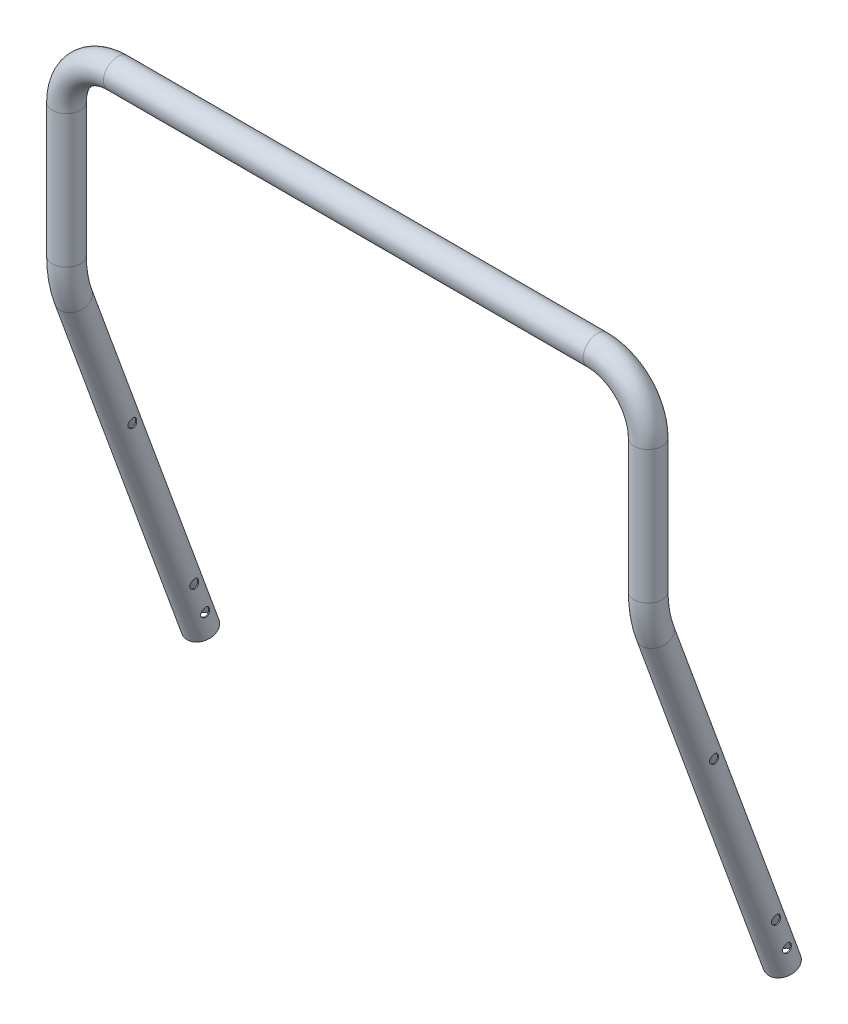
from build123d import *

# Parameters (mm, degrees)
SKETCH9_R                      = 11
SKETCH9_R_2                    = 10.2
SKETCH9_2_R                    = 11
SKETCH9_2_R_2                  = 10.2
CUT_EXTRUDE1_REACH             = 662.264
SKETCH14_R                     = 3.5
CUT_EXTRUDE1_DIRECTION_2_REACH = 662.264


with BuildPart() as part:
    # Sweep2: sweep along a path in Sketch8
    with BuildLine(Plane.XY) as sweep2_path:
        Line((-228, -100), (-228, -40))
        ThreePointArc((-228, -40), (-216.284271247, -11.715728753), (-188, 0))
        Line((-188, 0), (188, 0))
        ThreePointArc((188, 0), (216.284271247, -11.715728753), (228, -40))
        Line((228, -40), (228, -100))
    # Sketch9 → Sweep2 (sweep)
    with BuildSketch(Plane(origin=(228, -100, 0), x_dir=(-1, 0, 0), z_dir=(0, -1, 0))):
        Circle(SKETCH9_R)
        Circle(SKETCH9_R_2, mode=Mode.SUBTRACT)
    sweep(path=sweep2_path.line)

    # Sweep3: sweep along a path in Sketch13
    with BuildLine(Plane(origin=(228, 0, 0), x_dir=(0, 0, -1), z_dir=(1, 0, 0))) as sweep3_path:
        Line((0, -100), (0, -144.259708793))
        ThreePointArc((0, -144.259708793), (1.367302229, -159.888044783), (5.427664129, -175.041521693))
        Line((5.427664129, -175.041521693), (104.967762343, -448.525693866))
    # Sketch9<2> → Sweep3 (sweep)
    with BuildSketch(Plane(origin=(228, -100, 0), x_dir=(-1, 0, 0), z_dir=(0, -1, 0))):
        Circle(SKETCH9_2_R)
        Circle(SKETCH9_2_R_2, mode=Mode.SUBTRACT)
    sweep3 = sweep(path=sweep3_path.line)

    # Mirror1: Sweep3 across plane
    add(sweep3.mirror(Plane(origin=(0, 0, 0), x_dir=(0, 0, 1), z_dir=(1, 0, 0))))

    # Sketch14 → Cut-Extrude1 (cut, up to next)
    with BuildSketch(Plane(origin=(228, 0, 0), x_dir=(0, 0, -1), z_dir=(1, 0, 0)), mode=Mode.PRIVATE) as cut_extrude1_sk1:
        with Locations((41.055908138, -272.929317602)):
            Circle(SKETCH14_R)
    cut_extrude1_tool1 = extrude(cut_extrude1_sk1.sketch, amount=-CUT_EXTRUDE1_REACH, mode=Mode.PRIVATE) & part.part
    # Sketch14 → Cut-Extrude1 (cut, up to next)
    with BuildSketch(Plane(origin=(228, 0, 0), x_dir=(0, 0, -1), z_dir=(1, 0, 0)), mode=Mode.PRIVATE) as cut_extrude1_sk2:
        with Locations((89.622768491, -406.365669754)):
            Circle(SKETCH14_R)
    cut_extrude1_tool2 = extrude(cut_extrude1_sk2.sketch, amount=-CUT_EXTRUDE1_REACH, mode=Mode.PRIVATE) & part.part
    # Sketch14 → Cut-Extrude1 (cut, up to next)
    with BuildSketch(Plane(origin=(228, 0, 0), x_dir=(0, 0, -1), z_dir=(1, 0, 0)), mode=Mode.PRIVATE) as cut_extrude1_sk3:
        with Locations((98.173272074, -429.857985274)):
            Circle(SKETCH14_R)
    cut_extrude1_tool3 = extrude(cut_extrude1_sk3.sketch, amount=-CUT_EXTRUDE1_REACH, mode=Mode.PRIVATE) & part.part
    cut_extrude1_1 = cut_extrude1_tool1.solids().sort_by_distance((228, -272.929318, -41.055908))[0]
    add(cut_extrude1_1, mode=Mode.SUBTRACT)
    cut_extrude1_2 = cut_extrude1_tool2.solids().sort_by_distance((228, -406.36567, -89.622768))[0]
    add(cut_extrude1_2, mode=Mode.SUBTRACT)
    cut_extrude1_3 = cut_extrude1_tool3.solids().sort_by_distance((228, -429.857985, -98.173272))[0]
    add(cut_extrude1_3, mode=Mode.SUBTRACT)
    cut_extrude1 = cut_extrude1_1 + cut_extrude1_2 + cut_extrude1_3  # Cut-Extrude1 as one shape, for the pattern or mirror that repeats it

    # Sketch14 → Cut-Extrude1 direction 2 (cut, up to next)
    with BuildSketch(Plane(origin=(228, 0, 0), x_dir=(0, 0, -1), z_dir=(1, 0, 0)), mode=Mode.PRIVATE) as cut_extrude1_direction_2_sk1:
        with Locations((41.055908138, -272.929317602)):
            Circle(SKETCH14_R)
    cut_extrude1_direction_2_tool1 = extrude(cut_extrude1_direction_2_sk1.sketch, amount=CUT_EXTRUDE1_DIRECTION_2_REACH, mode=Mode.PRIVATE) & part.part
    # Sketch14 → Cut-Extrude1 direction 2 (cut, up to next)
    with BuildSketch(Plane(origin=(228, 0, 0), x_dir=(0, 0, -1), z_dir=(1, 0, 0)), mode=Mode.PRIVATE) as cut_extrude1_direction_2_sk2:
        with Locations((89.622768491, -406.365669754)):
            Circle(SKETCH14_R)
    cut_extrude1_direction_2_tool2 = extrude(cut_extrude1_direction_2_sk2.sketch, amount=CUT_EXTRUDE1_DIRECTION_2_REACH, mode=Mode.PRIVATE) & part.part
    # Sketch14 → Cut-Extrude1 direction 2 (cut, up to next)
    with BuildSketch(Plane(origin=(228, 0, 0), x_dir=(0, 0, -1), z_dir=(1, 0, 0)), mode=Mode.PRIVATE) as cut_extrude1_direction_2_sk3:
        with Locations((98.173272074, -429.857985274)):
            Circle(SKETCH14_R)
    cut_extrude1_direction_2_tool3 = extrude(cut_extrude1_direction_2_sk3.sketch, amount=CUT_EXTRUDE1_DIRECTION_2_REACH, mode=Mode.PRIVATE) & part.part
    cut_extrude1_direction_2_1 = cut_extrude1_direction_2_tool1.solids().sort_by_distance((228, -272.929318, -41.055908))[0]
    add(cut_extrude1_direction_2_1, mode=Mode.SUBTRACT)
    cut_extrude1_direction_2_2 = cut_extrude1_direction_2_tool2.solids().sort_by_distance((228, -406.36567, -89.622768))[0]
    add(cut_extrude1_direction_2_2, mode=Mode.SUBTRACT)
    cut_extrude1_direction_2_3 = cut_extrude1_direction_2_tool3.solids().sort_by_distance((228, -429.857985, -98.173272))[0]
    add(cut_extrude1_direction_2_3, mode=Mode.SUBTRACT)
    cut_extrude1_direction_2 = cut_extrude1_direction_2_1 + cut_extrude1_direction_2_2 + cut_extrude1_direction_2_3  # Cut-Extrude1 direction 2 as one shape, for the pattern or mirror that repeats it

    # Mirror2: Cut-Extrude1, Cut-Extrude1 direction 2 across plane
    add(cut_extrude1.mirror(Plane(origin=(0, 0, 0), x_dir=(0, 0, 1), z_dir=(1, 0, 0))), mode=Mode.SUBTRACT)
    add(cut_extrude1_direction_2.mirror(Plane(origin=(0, 0, 0), x_dir=(0, 0, 1), z_dir=(1, 0, 0))), mode=Mode.SUBTRACT)


solid = part.part
